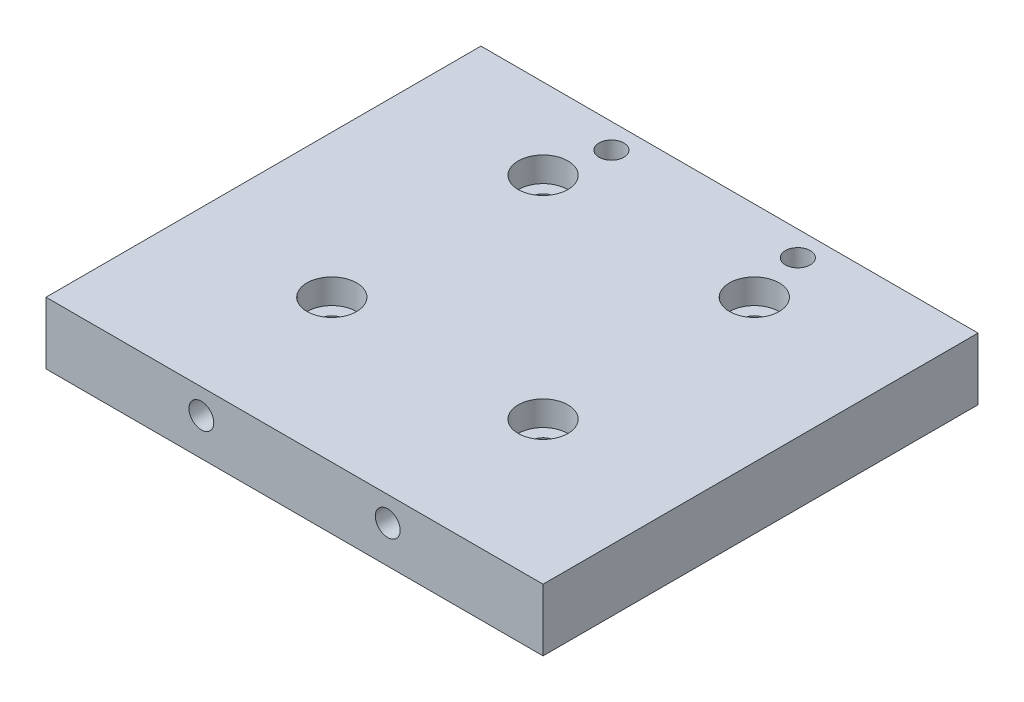
from build123d import *

# Parameters (mm, degrees)
SKETCH2_W           = 40
SKETCH2_H           = 30
SKETCH2_R           = 1
BOSS_EXTRUDE1_DEPTH = 5
SKETCH3_R           = 2
CUT_EXTRUDE1_DEPTH  = 2
SKETCH5_R           = 1
CUT_EXTRUDE2_DEPTH  = 26.495097568
SKETCH7_W           = 40
SKETCH7_H           = 5
BOSS_EXTRUDE2_DEPTH = 5
SKETCH8_R           = 1
CUT_EXTRUDE3_DEPTH  = 5


with BuildPart() as part:
    # Sketch2 → Boss-Extrude1 (new body)
    with BuildSketch(Plane(origin=(0, 0, 0), x_dir=(1, 0, 0), z_dir=(0, 1, 0))):
        Rectangle(SKETCH2_W, SKETCH2_H)
        with Locations((-8.5, 8.5)):
            Circle(SKETCH2_R, mode=Mode.SUBTRACT)
        with Locations((8.5, 8.5)):
            Circle(SKETCH2_R, mode=Mode.SUBTRACT)
        with Locations((8.5, -8.5)):
            Circle(SKETCH2_R, mode=Mode.SUBTRACT)
        with Locations((-8.5, -8.5)):
            Circle(SKETCH2_R, mode=Mode.SUBTRACT)
    extrude(amount=BOSS_EXTRUDE1_DEPTH)

    # Sketch3 → Cut-Extrude1 (cut)
    with BuildSketch(Plane(origin=(0, 5, 0), x_dir=(1, 0, 0), z_dir=(0, 1, 0))):
        with Locations((-8.5, 8.5)):
            Circle(SKETCH3_R)
        with Locations((8.5, 8.5)):
            Circle(SKETCH3_R)
        with Locations((8.5, -8.5)):
            Circle(SKETCH3_R)
        with Locations((-8.5, -8.5)):
            Circle(SKETCH3_R)
    extrude(amount=-CUT_EXTRUDE1_DEPTH, mode=Mode.SUBTRACT)

    # Sketch5 → Cut-Extrude2 (cut, through all)
    with BuildSketch(Plane.XZ):
        with Locations((-7.5, -13)):
            Circle(SKETCH5_R)
        with Locations((7.5, -13)):
            Circle(SKETCH5_R)
    extrude(amount=-CUT_EXTRUDE2_DEPTH, mode=Mode.SUBTRACT)

    # Sketch7 → Boss-Extrude2 (add)
    with BuildSketch(Plane.XY.offset(15)):
        with Locations((0, 2.5)):
            Rectangle(SKETCH7_W, SKETCH7_H)
    extrude(amount=BOSS_EXTRUDE2_DEPTH)

    # Sketch8 → Cut-Extrude3 (cut)
    with BuildSketch(Plane.XY.offset(20)):
        with Locations((-7.5, 3)):
            Circle(SKETCH8_R)
        with Locations((7.5, 3)):
            Circle(SKETCH8_R)
    extrude(amount=-CUT_EXTRUDE3_DEPTH, mode=Mode.SUBTRACT)


solid = part.part
